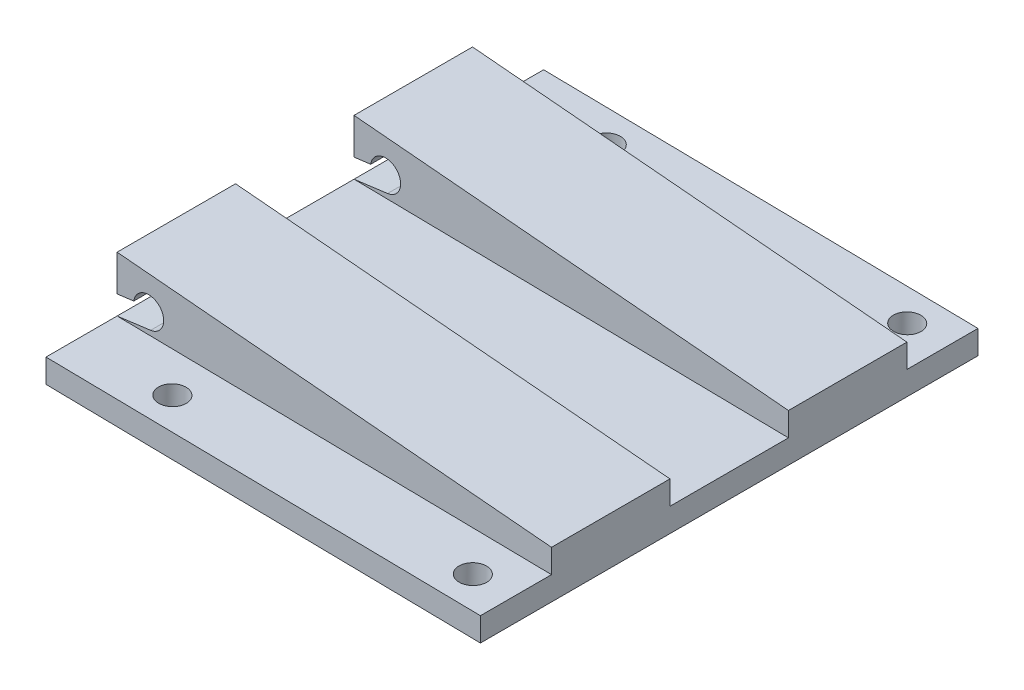
from build123d import *

# Parameters (mm, degrees)
BOSS_EXTRUDE1_DEPTH     = 63
CUT_EXTRUDE1_START      = 24
CUT_EXTRUDE1_DEPTH      = 15
CUT_EXTRUDE1_2_DEPTH    = 9
CUT_EXTRUDE1_START_2    = 54
CUT_EXTRUDE1_3_DEPTH    = 9
CUT_EXTRUDE2_DEPTH      = 78.723870207
CUT_EXTRUDE2_DEPTH_BACK = 78.723870207
SKETCH3_R               = 1.9
SKETCH4_R               = 1.75
CUT_EXTRUDE3_DEPTH      = 84.891904797
CUT_EXTRUDE4_DEPTH      = 78.723870207


# Read off the part's stored shape, not the designer's step: Cut-Extrude1
with BuildPart() as part:
    # Sketch1 → Boss-Extrude1 (new body)
    with BuildSketch(Plane.XY):
        Polygon((0, 0), (55, -0.860341408), (55, 5.139658592), (0, 10), align=None)
    extrude(amount=BOSS_EXTRUDE1_DEPTH)

    # Cut-Extrude1 outline → Cut-Extrude1 (cut)
    with BuildSketch(Plane.XY.offset(CUT_EXTRUDE1_START)):
        Polygon((0, 10), (0, 3), (55, 2.139658592), (55, 5.139658592), align=None)
    extrude(amount=CUT_EXTRUDE1_DEPTH, mode=Mode.SUBTRACT)

    # Cut-Extrude1 2 outline → Cut-Extrude1 2 (cut)
    with BuildSketch(Plane.XY):
        Polygon((0, 10), (0, 3), (55, 2.139658592), (55, 5.139658592), align=None)
    extrude(amount=CUT_EXTRUDE1_2_DEPTH, mode=Mode.SUBTRACT)

    # Cut-Extrude1 3 outline → Cut-Extrude1 3 (cut)
    with BuildSketch(Plane.XY.offset(CUT_EXTRUDE1_START_2)):
        Polygon((0, 10), (0, 3), (55, 2.139658592), (55, 5.139658592), align=None)
    extrude(amount=CUT_EXTRUDE1_3_DEPTH, mode=Mode.SUBTRACT)

    # Sketch3 → Cut-Extrude2 (cut, two sides: drawn at the far end of the back side and taken through both)
    with BuildSketch(Plane(origin=(0, 0, 9), x_dir=(-1, 0, 0), z_dir=(0, 0, -1)).offset(-CUT_EXTRUDE2_DEPTH_BACK)):
        with Locations(Location((-4, 5.438102572, 0), (0, 0, 90))):
            Circle(SKETCH3_R)
    extrude(amount=CUT_EXTRUDE2_DEPTH + CUT_EXTRUDE2_DEPTH_BACK, mode=Mode.SUBTRACT)

    # Sketch4 → Cut-Extrude3 (cut, through all)
    with BuildSketch(Plane(origin=(0.046916233, 2.999266109, 0), x_dir=(0.9998776774332501, -0.01564065761691552, 0), z_dir=(0.01564065761691552, 0.9998776774332501, 0))):
        with Locations(Location((11.953078027, -59, 0), (0, 0, 180))):
            Circle(SKETCH4_R)
        with Locations(Location((50, -59, 0), (0, 0, 180))):
            Circle(SKETCH4_R)
        with Locations(Location((50, -4, 0), (0, 0, 180))):
            Circle(SKETCH4_R)
        with Locations(Location((11.953078027, -4, 0), (0, 0, 180))):
            Circle(SKETCH4_R)
    extrude(amount=-CUT_EXTRUDE3_DEPTH, mode=Mode.SUBTRACT)

    # Sketch6 → Cut-Extrude4 (cut, through all)
    with BuildSketch(Plane.XY.offset(54)):
        Polygon((2.117680715, 5.69670286), (0, 5.420349449), (0, 3), (4.245861834, 3.554077106), align=None)
    extrude(amount=-CUT_EXTRUDE4_DEPTH, mode=Mode.SUBTRACT)


solid = part.part
